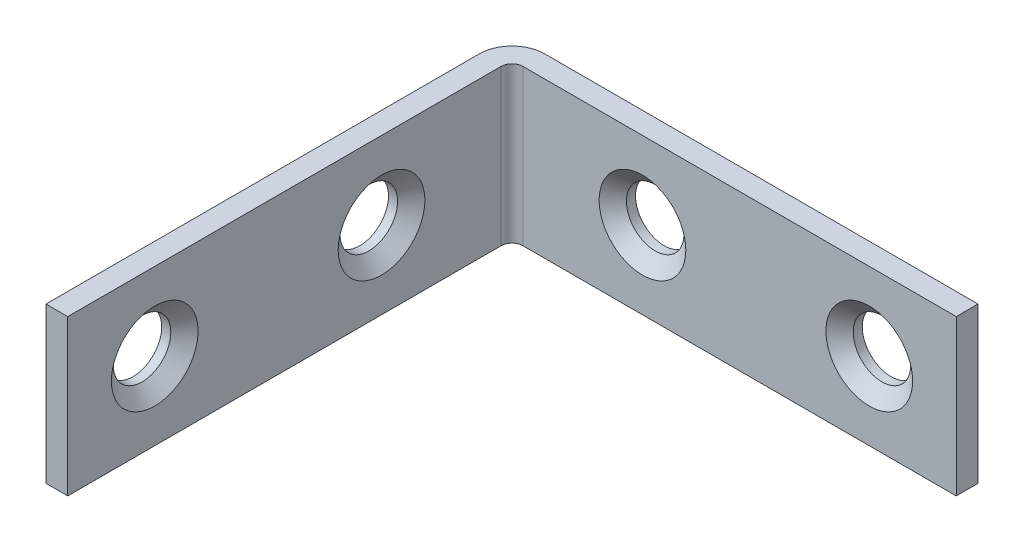
from build123d import *

# Parameters (mm, degrees)
EXTRUDE_THIN1_START          = -6.35
EXTRUDE_THIN1_DEPTH          = 12.7
SKETCH4_R                    = 2.3495
EXTRUDE3_DEPTH               = 51.526212207
SKETCH7_R                    = 3.5433
CUT_EXTRUDE1_DEPTH           = 54.020940995
CUT_EXTRUDE1_DRAFT           = -49
CUT_EXTRUDE1_PROFILE_2_DEPTH = 54.020940995
CUT_EXTRUDE1_PROFILE_2_DRAFT = -49
CIRPATTERN1_COUNT            = 2
CIRPATTERN1_COPY_1_SKETCH_R  = 3.5433
CIRPATTERN1_COPY_1_DEPTH     = 54.020940995
CIRPATTERN1_COPY_1_DRAFT     = -49
CIRPATTERN1_COPY_2_SKETCH_R  = 3.5433
CIRPATTERN1_COPY_2_DEPTH     = 54.020940995
CIRPATTERN1_COPY_2_DRAFT     = -49
CIRPATTERN1_COPY_3_SKETCH_R  = 3.5433
CIRPATTERN1_COPY_3_DEPTH     = 54.020940995
CIRPATTERN1_COPY_3_DRAFT     = -49


# Read off the part's stored shape, not the designer's step: Extrude-Thin1
with BuildPart() as part:
    # Extrude-Thin1 outline → Extrude-Thin1 (new body)
    with BuildSketch(Plane(origin=(0, 0, 0), x_dir=(1, 0, 0), z_dir=(0, 1, 0)).offset(EXTRUDE_THIN1_START)):
        with BuildLine():
            Line((2.667, -1.778), (38.1, -1.778))
            Line((38.1, -1.778), (38.1, 0))
            Line((38.1, 0), (2.667, 0))
            ThreePointArc((2.667, 0), (0.781146215, -0.781146215), (0, -2.667))
            Line((0, -2.667), (0, -38.1))
            Line((0, -38.1), (1.778, -38.1))
            Line((1.778, -38.1), (1.778, -2.667))
            ThreePointArc((1.778, -2.667), (2.038382072, -2.038382072), (2.667, -1.778))
        make_face()
    extrude(amount=EXTRUDE_THIN1_DEPTH)

    # Sketch4 → Extrude3 (cut, through all)
    with BuildSketch(Plane(origin=(3.556, 0, 1.778), x_dir=(1, 0, 0), z_dir=(0, 0, 1))):
        with Locations((27.432, 0)):
            Circle(SKETCH4_R)
        with Locations((8.89, 0)):
            Circle(SKETCH4_R)
    extrude3 = extrude(amount=-EXTRUDE3_DEPTH, mode=Mode.SUBTRACT)


with BuildPart() as cut_extrude1_tool:
    # Sketch7 → Cut-Extrude1 (with draft: the straight prism first)
    with BuildSketch(Plane.XY.offset(1.778)):
        with Locations((30.988, 0)):
            Circle(SKETCH7_R)
    extrude(amount=-CUT_EXTRUDE1_DEPTH)
    # Cut-Extrude1: the draft: its side faces are tilted about the plane it starts from
    cut_extrude1_sides = [cut_extrude1_tool.faces().sort_by_distance(p)[0] for p in [
        (27.4447, 0, -25.232470498),
    ]]
    draft(cut_extrude1_sides, Plane.XY.offset(1.778), CUT_EXTRUDE1_DRAFT)


with BuildPart() as part_1:
    add(part.part)

    # Cut-Extrude1: cut by cut_extrude1_tool
    add(cut_extrude1_tool.part, mode=Mode.SUBTRACT)


with BuildPart() as cut_extrude1_profile_2_tool:
    # Sketch7 → Cut-Extrude1 profile 2 (with draft: the straight prism first)
    with BuildSketch(Plane.XY.offset(1.778)):
        with Locations((12.446, 0)):
            Circle(SKETCH7_R)
    extrude(amount=-CUT_EXTRUDE1_PROFILE_2_DEPTH)
    # Cut-Extrude1 profile 2: the draft: its side faces are tilted about the plane it starts from
    cut_extrude1_profile_2_sides = [cut_extrude1_profile_2_tool.faces().sort_by_distance(p)[0] for p in [
        (8.9027, 0, -25.232470498),
    ]]
    draft(cut_extrude1_profile_2_sides, Plane.XY.offset(1.778), CUT_EXTRUDE1_PROFILE_2_DRAFT)


with BuildPart() as part_2:
    add(part_1.part)

    # Cut-Extrude1 profile 2: cut by cut_extrude1_profile_2_tool
    add(cut_extrude1_profile_2_tool.part, mode=Mode.SUBTRACT)

    # CirPattern1: Extrude3 ×2 about axis
    cirpattern1_axis = Axis((0, 0, 0), (0.7071067811865464, 0, 0.7071067811865487))
    for i in range(1, CIRPATTERN1_COUNT):
        add(extrude3.rotate(cirpattern1_axis, i * 360 / CIRPATTERN1_COUNT), mode=Mode.SUBTRACT)


with BuildPart() as cirpattern1_copy_1_tool:
    # CirPattern1 copy 1 sketch → CirPattern1 copy 1 (with draft: the straight prism first)
    with BuildSketch(Plane(origin=(1.778, 0, 0), x_dir=(0, 0, 1), z_dir=(1, 0, 0))):
        with Locations((30.988, 0)):
            Circle(CIRPATTERN1_COPY_1_SKETCH_R)
    extrude(amount=-CIRPATTERN1_COPY_1_DEPTH)
    # CirPattern1 copy 1: the draft: its side faces are tilted about the plane it starts from
    cirpattern1_copy_1_sides = [cirpattern1_copy_1_tool.faces().sort_by_distance(p)[0] for p in [
        (-25.232470498, 0, 27.4447),
    ]]
    draft(cirpattern1_copy_1_sides, Plane(origin=(1.778, 0, 0), x_dir=(0, 0, 1), z_dir=(1, 0, 0)), CIRPATTERN1_COPY_1_DRAFT)


with BuildPart() as part_3:
    add(part_2.part)

    # CirPattern1 copy 1: cut by cirpattern1_copy_1_tool
    add(cirpattern1_copy_1_tool.part, mode=Mode.SUBTRACT)


with BuildPart() as cirpattern1_copy_2_tool:
    # CirPattern1 copy 2 sketch → CirPattern1 copy 2 (with draft: the straight prism first)
    with BuildSketch(Plane(origin=(1.778, 0, 0), x_dir=(0, 0, 1), z_dir=(1, 0, 0))):
        with Locations((12.446, 0)):
            Circle(CIRPATTERN1_COPY_2_SKETCH_R)
    extrude(amount=-CIRPATTERN1_COPY_2_DEPTH)
    # CirPattern1 copy 2: the draft: its side faces are tilted about the plane it starts from
    cirpattern1_copy_2_sides = [cirpattern1_copy_2_tool.faces().sort_by_distance(p)[0] for p in [
        (-25.232470498, 0, 8.9027),
    ]]
    draft(cirpattern1_copy_2_sides, Plane(origin=(1.778, 0, 0), x_dir=(0, 0, 1), z_dir=(1, 0, 0)), CIRPATTERN1_COPY_2_DRAFT)


with BuildPart() as part_4:
    add(part_3.part)

    # CirPattern1 copy 2: cut by cirpattern1_copy_2_tool
    add(cirpattern1_copy_2_tool.part, mode=Mode.SUBTRACT)


with BuildPart() as cirpattern1_copy_3_tool:
    # CirPattern1 copy 3 sketch → CirPattern1 copy 3 (with draft: the straight prism first)
    with BuildSketch(Plane(origin=(1.778, 0, 0), x_dir=(0, 0, 1), z_dir=(1, 0, 0))):
        with Locations((12.446, 0)):
            Circle(CIRPATTERN1_COPY_3_SKETCH_R)
    extrude(amount=-CIRPATTERN1_COPY_3_DEPTH)
    # CirPattern1 copy 3: the draft: its side faces are tilted about the plane it starts from
    cirpattern1_copy_3_sides = [cirpattern1_copy_3_tool.faces().sort_by_distance(p)[0] for p in [
        (-25.232470498, 0, 8.9027),
    ]]
    draft(cirpattern1_copy_3_sides, Plane(origin=(1.778, 0, 0), x_dir=(0, 0, 1), z_dir=(1, 0, 0)), CIRPATTERN1_COPY_3_DRAFT)


with BuildPart() as part_5:
    add(part_4.part)

    # CirPattern1 copy 3: cut by cirpattern1_copy_3_tool
    add(cirpattern1_copy_3_tool.part, mode=Mode.SUBTRACT)


solid = part_5.part
